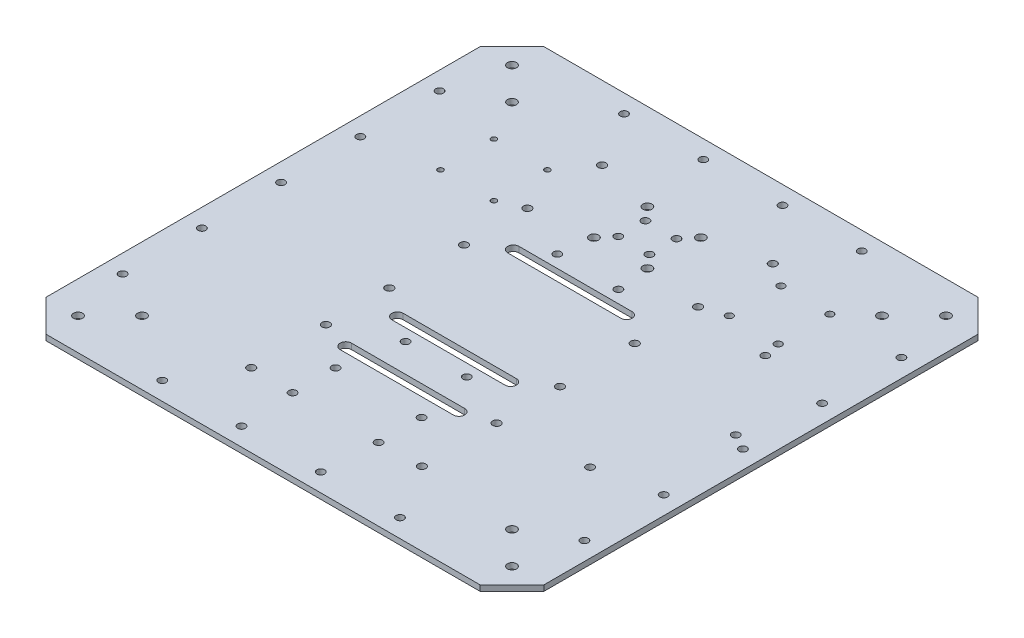
from build123d import *

# Parameters (mm, degrees)
BOSS_EXTRUDE1_DEPTH = 3.175
SKETCH2_R           = 2.159
CUT_EXTRUDE1_DEPTH  = 257.37661277
CUT_EXTRUDE2_DEPTH  = 257.37661277
SKETCH7_R           = 1.524
CUT_EXTRUDE3_DEPTH  = 257.37661277
SKETCH10_R          = 2.159
CUT_EXTRUDE6_DEPTH  = 257.37661277
SKETCH9_R           = 2.032
CUT_EXTRUDE5_DEPTH  = 257.37661277
SKETCH13_R          = 2.54
SKETCH13_R_2        = 2.159
CUT_EXTRUDE8_DEPTH  = 257.37661277
SKETCH14_R          = 2.54
CUT_EXTRUDE9_DEPTH  = 257.37661277
SKETCH15_R          = 2.159
CUT_EXTRUDE10_DEPTH = 257.37661277
SKETCH16_R          = 2.159
CUT_EXTRUDE11_DEPTH = 257.37661277
SKETCH17_R          = 2.2225
CUT_EXTRUDE13_DEPTH = 257.37661277


with BuildPart() as part:
    # Sketch1 → Boss-Extrude1 (new body)
    with BuildSketch(Plane(origin=(0, 0, 0), x_dir=(1, 0, 0), z_dir=(0, 1, 0))):
        Polygon((-142.524216069, 79.491173458), (-160.484728311, 61.530661216), (-160.484728311, -181.9483143), (-142.524216069, -199.908826542), (100.954759447, -199.908826542), (118.915271689, -181.9483143), (118.915271689, 61.530661216), (100.954759447, 79.491173458), align=None)
    extrude(amount=BOSS_EXTRUDE1_DEPTH)

    # Sketch2 → Cut-Extrude1 (cut, through all)
    with BuildSketch(Plane(origin=(0, 3.175, 0), x_dir=(1, 0, 0), z_dir=(0, 1, 0))):
        with Locations((-38.056728311, -17.536826542)):
            Circle(SKETCH2_R)
        with Locations((-3.766728311, -17.536826542)):
            Circle(SKETCH2_R)
        with Locations((-38.056728311, -102.626826542)):
            Circle(SKETCH2_R)
        with Locations((-3.766728311, -102.626826542)):
            Circle(SKETCH2_R)
    extrude(amount=-CUT_EXTRUDE1_DEPTH, mode=Mode.SUBTRACT)

    # Sketch4 → Cut-Extrude2 (cut, through all)
    with BuildSketch(Plane(origin=(0, 3.175, 0), x_dir=(1, 0, 0), z_dir=(0, 1, 0))):
        with BuildLine():
            Line((-52.534728311, -24.533826542), (10.965271689, -24.533826542))
            ThreePointArc((10.965271689, -24.533826542), (14.140271689, -27.708826542), (10.965271689, -30.883826542))
            Line((10.965271689, -30.883826542), (-52.534728311, -30.883826542))
            ThreePointArc((-52.534728311, -30.883826542), (-55.709728311, -27.708826542), (-52.534728311, -24.533826542))
        make_face()
        with BuildLine():
            Line((-52.534728311, -89.533826542), (10.965271689, -89.533826542))
            ThreePointArc((10.965271689, -89.533826542), (14.140271689, -92.708826542), (10.965271689, -95.883826542))
            Line((10.965271689, -95.883826542), (-52.534728311, -95.883826542))
            ThreePointArc((-52.534728311, -95.883826542), (-55.709728311, -92.708826542), (-52.534728311, -89.533826542))
        make_face()
        with BuildLine():
            Line((-52.534728311, -118.533006542), (10.965271689, -118.533006542))
            ThreePointArc((10.965271689, -118.533006542), (14.140271689, -121.708006542), (10.965271689, -124.883006542))
            Line((10.965271689, -124.883006542), (-52.534728311, -124.883006542))
            ThreePointArc((-52.534728311, -124.883006542), (-55.709728311, -121.708006542), (-52.534728311, -118.533006542))
        make_face()
    extrude(amount=-CUT_EXTRUDE2_DEPTH, mode=Mode.SUBTRACT)

    # Sketch7 → Cut-Extrude3 (cut, through all)
    with BuildSketch(Plane(origin=(0, 3.175, 0), x_dir=(1, 0, 0), z_dir=(0, 1, 0))):
        with Locations((-81.744728311, 20.563173458)):
            Circle(SKETCH7_R)
        with Locations((-81.744728311, -9.408826542)):
            Circle(SKETCH7_R)
        with Locations((-111.716728311, -9.408826542)):
            Circle(SKETCH7_R)
        with Locations((-111.716728311, 20.563173458)):
            Circle(SKETCH7_R)
    extrude(amount=-CUT_EXTRUDE3_DEPTH, mode=Mode.SUBTRACT)

    # Sketch10 → Cut-Extrude6 (cut, through all)
    with BuildSketch(Plane.XZ):
        with Locations((-44.914728311, 159.173006542)):
            Circle(SKETCH10_R)
        with Locations((3.345271689, 159.173006542)):
            Circle(SKETCH10_R)
        with Locations((-44.914728311, 135.043006542)):
            Circle(SKETCH10_R)
        with Locations((3.345271689, 135.043006542)):
            Circle(SKETCH10_R)
    extrude(amount=-CUT_EXTRUDE6_DEPTH, mode=Mode.SUBTRACT)

    # Sketch9 → Cut-Extrude5 (cut, through all)
    with BuildSketch(Plane(origin=(0, 0, 0), x_dir=(-1, 0, 0), z_dir=(0, -1, 0))):
        with Locations((-40.175271689, 0.751173458)):
            Circle(SKETCH9_R)
        with Locations((-67.607271689, 0.751173458)):
            Circle(SKETCH9_R)
        with Locations((-40.175271689, 29.707173458)):
            Circle(SKETCH9_R)
        with Locations((-67.607271689, 29.707173458)):
            Circle(SKETCH9_R)
    extrude(amount=-CUT_EXTRUDE5_DEPTH, mode=Mode.SUBTRACT)

    # Sketch13 → Cut-Extrude8 (cut, through all)
    with BuildSketch(Plane.XZ):
        with Locations((-35.784728311, -0.751173458)):
            Circle(SKETCH13_R)
        with Locations((-35.784728311, -30.751173458)):
            Circle(SKETCH13_R)
        with Locations((-5.784728311, -30.751173458)):
            Circle(SKETCH13_R)
        with Locations((-5.784728311, -0.751173458)):
            Circle(SKETCH13_R)
        with Locations((-29.517788658, -23.371173458)):
            Circle(SKETCH13_R_2)
        with Locations((-29.517788658, -8.131173458)):
            Circle(SKETCH13_R_2)
        with Locations((-12.051667964, -8.131173458)):
            Circle(SKETCH13_R_2)
        with Locations((-12.051667964, -23.371173458)):
            Circle(SKETCH13_R_2)
    extrude(amount=-CUT_EXTRUDE8_DEPTH, mode=Mode.SUBTRACT)

    # Sketch14 → Cut-Extrude9 (cut, through all)
    with BuildSketch(Plane.XZ):
        with Locations((-142.524216069, 181.9483143)):
            Circle(SKETCH14_R)
        with Locations((-124.563703827, 163.987802058)):
            Circle(SKETCH14_R)
        with Locations((82.994247204, 163.987802058)):
            Circle(SKETCH14_R)
        with Locations((100.954759447, 181.9483143)):
            Circle(SKETCH14_R)
        with Locations((-142.524216069, -61.530661216)):
            Circle(SKETCH14_R)
        with Locations((-124.563703827, -43.570148974)):
            Circle(SKETCH14_R)
        with Locations((100.954759447, -61.530661216)):
            Circle(SKETCH14_R)
        with Locations((82.994247204, -43.570148974)):
            Circle(SKETCH14_R)
    extrude(amount=-CUT_EXTRUDE9_DEPTH, mode=Mode.SUBTRACT)

    # Sketch15 → Cut-Extrude10 (cut, through all)
    with BuildSketch(Plane.XZ):
        with Locations((-43.009728311, 189.748826542)):
            Circle(SKETCH15_R)
        with Locations((-87.459728311, 189.748826542)):
            Circle(SKETCH15_R)
        with Locations((-150.324728311, 60.208826542)):
            Circle(SKETCH15_R)
        with Locations((-150.324728311, 104.658826542)):
            Circle(SKETCH15_R)
        with Locations((-150.324728311, 149.108826542)):
            Circle(SKETCH15_R)
        with Locations((108.755271689, 149.108826542)):
            Circle(SKETCH15_R)
        with Locations((108.755271689, 104.658826542)):
            Circle(SKETCH15_R)
        with Locations((108.755271689, 60.208826542)):
            Circle(SKETCH15_R)
        with Locations((45.890271689, 189.748826542)):
            Circle(SKETCH15_R)
        with Locations((1.440271689, 189.748826542)):
            Circle(SKETCH15_R)
        with Locations((1.440271689, -69.331173458)):
            Circle(SKETCH15_R)
        with Locations((45.890271689, -69.331173458)):
            Circle(SKETCH15_R)
        with Locations((108.755271689, 15.758826542)):
            Circle(SKETCH15_R)
        with Locations((108.755271689, -28.691173458)):
            Circle(SKETCH15_R)
        with Locations((-150.324728311, -28.691173458)):
            Circle(SKETCH15_R)
        with Locations((-150.324728311, 15.758826542)):
            Circle(SKETCH15_R)
        with Locations((-87.459728311, -69.331173458)):
            Circle(SKETCH15_R)
        with Locations((-43.009728311, -69.331173458)):
            Circle(SKETCH15_R)
    extrude(amount=-CUT_EXTRUDE10_DEPTH, mode=Mode.SUBTRACT)

    # Sketch16 → Cut-Extrude11 (cut, through all)
    with BuildSketch(Plane(origin=(0, 0, 0), x_dir=(-1, 0, 0), z_dir=(0, -1, 0))):
        with Locations((-74.719271689, -111.897826542)):
            Circle(SKETCH16_R)
        with Locations((-69.639271689, -8.519826542)):
            Circle(SKETCH16_R)
        with Locations((-99.865271689, -55.341826542)):
            Circle(SKETCH16_R)
    extrude(amount=-CUT_EXTRUDE11_DEPTH, mode=Mode.SUBTRACT)

    # Sketch17 → Cut-Extrude13 (cut, through all)
    with BuildSketch(Plane(origin=(0, 3.175, 0), x_dir=(1, 0, 0), z_dir=(0, 1, 0))):
        with Locations((27.094271689, -158.633826542)):
            Circle(SKETCH17_R)
        with Locations((-68.663728311, -158.633826542)):
            Circle(SKETCH17_R)
        with Locations((27.094271689, -116.723826542)):
            Circle(SKETCH17_R)
        with Locations((-68.663728311, -116.723826542)):
            Circle(SKETCH17_R)
        with Locations((27.094271689, -81.163826542)):
            Circle(SKETCH17_R)
        with Locations((-68.663728311, -81.163826542)):
            Circle(SKETCH17_R)
        with Locations((27.094271689, -39.253826542)):
            Circle(SKETCH17_R)
        with Locations((-68.663728311, -39.253826542)):
            Circle(SKETCH17_R)
        with Locations((27.094271689, -3.693826542)):
            Circle(SKETCH17_R)
        with Locations((-68.663728311, -3.693826542)):
            Circle(SKETCH17_R)
        with Locations((27.094271689, 38.216173458)):
            Circle(SKETCH17_R)
        with Locations((-68.663728311, 38.216173458)):
            Circle(SKETCH17_R)
    extrude(amount=-CUT_EXTRUDE13_DEPTH, mode=Mode.SUBTRACT)


solid = part.part
